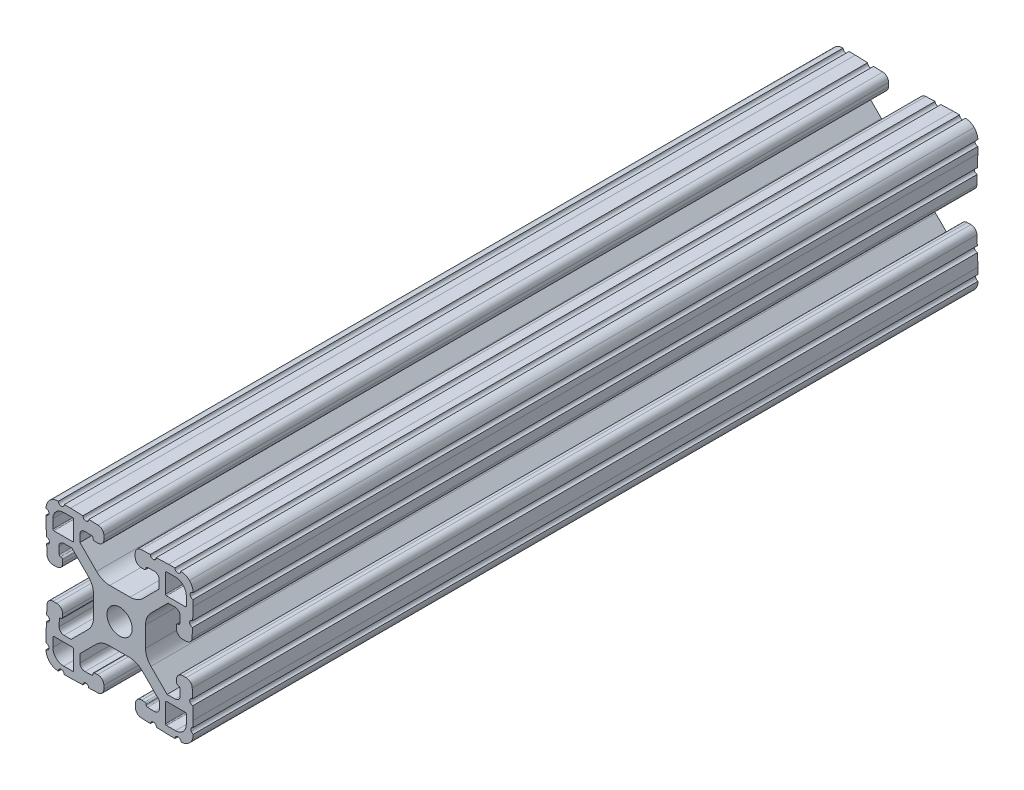
from build123d import *

# Parameters (mm, degrees)
SKETCH1_R           = 3.2639
BOSS_EXTRUDE1_DEPTH = 203.2


with BuildPart() as part:
    # Sketch1 → Boss-Extrude1 (new body)
    with BuildSketch(Plane(origin=(0, 0, -25.4), x_dir=(-1, 0, 0), z_dir=(0, 0, -1))):
        with BuildLine():
            Line((-88.043721549, 91.862643967), (-86.29674679, 91.923648859))
            ThreePointArc((-86.29674679, 91.923648859), (-85.370208675, 91.567983831), (-84.982425017, 90.654422489))
            Line((-84.982425017, 90.654422489), (-84.982425017, 88.800173916))
            Line((-84.982425017, 88.800173916), (-89.306565884, 84.476033049))
            ThreePointArc((-89.306565884, 84.476033049), (-90.866149908, 83.406077005), (-92.719610366, 83.029523439))
            Line((-92.719610366, 83.029523439), (-97.961628589, 83.029523439))
            ThreePointArc((-97.961628589, 83.029523439), (-99.779298356, 83.391080435), (-101.320244378, 84.42070765))
            Line((-101.320244378, 84.42070765), (-105.516001761, 88.616465033))
            Line((-105.516001761, 88.616465033), (-105.516001761, 90.731330035))
            ThreePointArc((-105.516001761, 90.731330035), (-105.128218103, 91.644891377), (-104.201679988, 92.000556406))
            Line((-104.201679988, 92.000556406), (-102.454705229, 91.939551513))
            ThreePointArc((-102.454705229, 91.939551513), (-102.193933359, 91.823448504), (-102.087001761, 91.558783602))
            ThreePointArc((-102.087001761, 91.558783602), (-102.010859042, 91.249291513), (-101.726191901, 91.105946874))
            Line((-101.726191901, 91.105946874), (-100.929727576, 91.078102142))
            ThreePointArc((-100.929727576, 91.078102142), (-99.780779944, 91.519102656), (-99.299905511, 92.651940638))
            Line((-99.299905511, 92.651940638), (-99.299905511, 93.566848638))
            ThreePointArc((-99.299905511, 93.566848638), (-99.741889517, 94.660796975), (-100.819746715, 95.140689345))
            Line((-100.819746715, 95.140689345), (-103.211918901, 95.224224422))
            ThreePointArc((-103.211918901, 95.224224422), (-104.000045777, 94.489281495), (-104.734990687, 95.277406522))
            Line((-104.734990687, 95.277406522), (-107.935905676, 95.389166912))
            Line((-107.935905676, 95.389166912), (-109.561454876, 95.389166912))
            ThreePointArc((-109.561454876, 95.389166912), (-110.323454876, 94.627166912), (-111.085454876, 95.389166912))
            ThreePointArc((-111.085454876, 95.389166912), (-112.308767787, 95.144035599), (-113.343184761, 94.446493225))
            ThreePointArc((-113.343184761, 94.446493225), (-114.04072548, 93.412075135), (-114.285854836, 92.188761832))
            ThreePointArc((-114.285854836, 92.188761832), (-113.523853616, 91.426762441), (-114.285853616, 90.664761832))
            Line((-114.285853616, 90.664761832), (-114.285853616, 89.039212632))
            Line((-114.285853616, 89.039212632), (-114.174093219, 85.838297643))
            ThreePointArc((-114.174093219, 85.838297643), (-113.385968191, 85.103352735), (-114.120911115, 84.315225857))
            Line((-114.120911115, 84.315225857), (-114.037376031, 81.923053667))
            ThreePointArc((-114.037376031, 81.923053667), (-113.55748366, 80.845196472), (-112.463535325, 80.403212468))
            Line((-112.463535325, 80.403212468), (-111.548627325, 80.403212468))
            ThreePointArc((-111.548627325, 80.403212468), (-110.415788905, 80.884087354), (-109.974788872, 82.033035791))
            Line((-109.974788872, 82.033035791), (-110.002634241, 82.829500094))
            ThreePointArc((-110.002634241, 82.829500094), (-110.118742417, 83.090261917), (-110.383401914, 83.197188))
            ThreePointArc((-110.383401914, 83.197188), (-110.693757401, 83.272605688), (-110.837665276, 83.557735272))
            Line((-110.837665276, 83.557735272), (-110.898671566, 85.304709982))
            ThreePointArc((-110.898671566, 85.304709982), (-110.543006925, 86.231248747), (-109.62944523, 86.61903277))
            Line((-109.62944523, 86.61903277), (-107.807161806, 86.61903277))
            Line((-107.807161806, 86.61903277), (-103.364925613, 82.176810793))
            ThreePointArc((-103.364925613, 82.176810793), (-102.335294479, 80.635862907), (-101.973736029, 78.81818963))
            Line((-101.973736029, 78.81818963), (-101.973736029, 73.576034207))
            ThreePointArc((-101.973736029, 73.576034207), (-102.335293752, 71.758362684), (-103.364922926, 70.21741573))
            Line((-103.364922926, 70.21741573), (-107.560683666, 66.021661704))
            Line((-107.560683666, 66.021661704), (-109.652436558, 66.021661704))
            ThreePointArc((-109.652436558, 66.021661704), (-110.565998503, 66.409445617), (-110.921663765, 67.335984343))
            Line((-110.921663765, 67.335984343), (-110.860658873, 69.082959102))
            ThreePointArc((-110.860658873, 69.082959102), (-110.744555864, 69.343730973), (-110.479890961, 69.45066257))
            ThreePointArc((-110.479890961, 69.45066257), (-110.173494703, 69.529390272), (-110.032185196, 69.812424443))
            Line((-110.032185196, 69.812424443), (-110.004340464, 70.608888768))
            ThreePointArc((-110.004340464, 70.608888768), (-110.445340978, 71.7578364), (-111.57817896, 72.238710833))
            Line((-111.57817896, 72.238710833), (-112.49308696, 72.238710833))
            ThreePointArc((-112.49308696, 72.238710833), (-113.587035297, 71.796726827), (-114.066927667, 70.718869629))
            Line((-114.066927667, 70.718869629), (-114.150462744, 68.326697443))
            ThreePointArc((-114.150462744, 68.326697443), (-113.415519817, 67.538570567), (-114.203644843, 66.803625657))
            Line((-114.203644843, 66.803625657), (-114.315405233, 63.602710668))
            Line((-114.315405233, 63.602710668), (-114.315405233, 61.962557497))
            ThreePointArc((-114.315405233, 61.962557497), (-113.701927281, 61.206106537), (-114.333208228, 60.464447842))
            ThreePointArc((-114.333208228, 60.464447842), (-114.113020459, 59.176546471), (-113.392816136, 58.086372941))
            ThreePointArc((-113.392816136, 58.086372941), (-112.358398046, 57.388832223), (-111.135084743, 57.143702867))
            ThreePointArc((-111.135084743, 57.143702867), (-110.373085352, 57.905704086), (-109.611084743, 57.143704086))
            Line((-109.611084743, 57.143704086), (-107.985535543, 57.143704086))
            Line((-107.985535543, 57.143704086), (-104.784620554, 57.255464483))
            ThreePointArc((-104.784620554, 57.255464483), (-104.049675645, 58.04358951), (-103.261548768, 57.308646586))
            Line((-103.261548768, 57.308646586), (-100.869376578, 57.39218167))
            ThreePointArc((-100.869376578, 57.39218167), (-99.791519383, 57.872074041), (-99.349535378, 58.966022376))
            Line((-99.349535378, 58.966022376), (-99.349535378, 59.880930376))
            ThreePointArc((-99.349535378, 59.880930376), (-99.830409811, 61.013768358), (-100.979357443, 61.454768873))
            Line((-100.979357443, 61.454768873), (-101.775821768, 61.42692414))
            ThreePointArc((-101.775821768, 61.42692414), (-102.036583684, 61.310816174), (-102.143509978, 61.046156762))
            ThreePointArc((-102.143509978, 61.046156762), (-102.222494916, 60.740061862), (-102.505377386, 60.598958297))
            Line((-102.505377386, 60.598958297), (-104.252352145, 60.537953405))
            ThreePointArc((-104.252352145, 60.537953405), (-105.17889026, 60.893618433), (-105.566673918, 61.807179775))
            Line((-105.566673918, 61.807179775), (-105.566673918, 63.629462758))
            Line((-105.566673918, 63.629462758), (-101.131142468, 68.064994208))
            ThreePointArc((-101.131142468, 68.064994208), (-99.590196446, 69.094621422), (-97.772526678, 69.456178419))
            Line((-97.772526678, 69.456178419), (-92.530356056, 69.456178419))
            ThreePointArc((-92.530356056, 69.456178419), (-90.712686289, 69.094621422), (-89.171740267, 68.064994208))
            Line((-89.171740267, 68.064994208), (-84.975982884, 63.869236825))
            Line((-84.975982884, 63.869236825), (-84.975982884, 61.781050107))
            ThreePointArc((-84.975982884, 61.781050107), (-85.363766542, 60.867488765), (-86.290304657, 60.511823736))
            Line((-86.290304657, 60.511823736), (-88.037279416, 60.572828629))
            ThreePointArc((-88.037279416, 60.572828629), (-88.298051286, 60.688931638), (-88.404982884, 60.95359654))
            ThreePointArc((-88.404982884, 60.95359654), (-88.466593694, 61.278962759), (-88.759626911, 61.433204782))
            Line((-88.759626911, 61.433204782), (-89.556091237, 61.461049514))
            ThreePointArc((-89.556091237, 61.461049514), (-90.705038868, 61.020049), (-91.185913301, 59.887211018))
            Line((-91.185913301, 59.887211018), (-91.185913301, 58.972303018))
            ThreePointArc((-91.185913301, 58.972303018), (-90.743929295, 57.878354681), (-89.666072098, 57.398462311))
            Line((-89.666072098, 57.398462311), (-87.273899911, 57.314927234))
            ThreePointArc((-87.273899911, 57.314927234), (-86.485773036, 58.049870161), (-85.750828126, 57.261745135))
            Line((-85.750828126, 57.261745135), (-82.549913136, 57.149984745))
            Line((-82.549913136, 57.149984745), (-80.924363936, 57.149984745))
            ThreePointArc((-80.924363936, 57.149984745), (-80.162363936, 57.911984745), (-79.400363936, 57.149984745))
            ThreePointArc((-79.400363936, 57.149984745), (-78.177051025, 57.395116058), (-77.142634052, 58.092658432))
            ThreePointArc((-77.142634052, 58.092658432), (-76.445094372, 59.127074031), (-76.199963977, 60.350384428))
            ThreePointArc((-76.199963977, 60.350384428), (-76.961961268, 61.112385783), (-76.199961268, 61.874384428))
            Line((-76.199961268, 61.874384428), (-76.199961268, 63.499933628))
            Line((-76.199961268, 63.499933628), (-76.311721666, 66.700848617))
            ThreePointArc((-76.311721666, 66.700848617), (-77.099846694, 67.435793525), (-76.364903769, 68.223920403))
            Line((-76.364903769, 68.223920403), (-76.448438853, 70.616092593))
            ThreePointArc((-76.448438853, 70.616092593), (-76.928331225, 71.693949788), (-78.02227956, 72.135933792))
            Line((-78.02227956, 72.135933792), (-78.93718756, 72.135933792))
            ThreePointArc((-78.93718756, 72.135933792), (-80.07002598, 71.655058906), (-80.511026012, 70.506110469))
            Line((-80.511026012, 70.506110469), (-80.483180643, 69.709646166))
            ThreePointArc((-80.483180643, 69.709646166), (-80.367072468, 69.448884343), (-80.102412971, 69.34195826))
            ThreePointArc((-80.102412971, 69.34195826), (-79.796317908, 69.262973649), (-79.655214052, 68.980091239))
            Line((-79.655214052, 68.980091239), (-79.594207761, 67.233116529))
            ThreePointArc((-79.594207761, 67.233116529), (-79.949872402, 66.306577764), (-80.863434097, 65.918793741))
            Line((-80.863434097, 65.918793741), (-82.685717521, 65.918793741))
            Line((-82.685717521, 65.918793741), (-87.121258001, 70.35431293))
            ThreePointArc((-87.121258001, 70.35431293), (-88.150863946, 71.895196205), (-88.512450271, 73.712794894))
            Line((-88.512450271, 73.712794894), (-88.512606864, 78.954950317))
            ThreePointArc((-88.512606864, 78.954950317), (-88.151076291, 80.772698182), (-87.121419968, 82.313710679))
            Line((-87.121419968, 82.313710679), (-82.925659228, 86.509464706))
            Line((-82.925659228, 86.509464706), (-80.837473527, 86.509464706))
            ThreePointArc((-80.837473527, 86.509464706), (-79.923911584, 86.121680793), (-79.568246321, 85.195142068))
            Line((-79.568246321, 85.195142068), (-79.629251214, 83.448167309))
            ThreePointArc((-79.629251214, 83.448167309), (-79.745354223, 83.187395438), (-80.010019125, 83.080463841))
            ThreePointArc((-80.010019125, 83.080463841), (-80.335385344, 83.018853031), (-80.489627367, 82.725819813))
            Line((-80.489627367, 82.725819813), (-80.5174721, 81.929355488))
            ThreePointArc((-80.5174721, 81.929355488), (-80.076471586, 80.780407856), (-78.943633603, 80.299533423))
            Line((-78.943633603, 80.299533423), (-78.028725603, 80.299533423))
            ThreePointArc((-78.028725603, 80.299533423), (-76.934777267, 80.741517429), (-76.454884897, 81.819374627))
            Line((-76.454884897, 81.819374627), (-76.37134982, 84.211546813))
            ThreePointArc((-76.37134982, 84.211546813), (-77.106292747, 84.999673689), (-76.31816772, 85.734618599))
            Line((-76.31816772, 85.734618599), (-76.20640733, 88.935533588))
            Line((-76.20640733, 88.935533588), (-76.20640733, 90.561082788))
            ThreePointArc((-76.20640733, 90.561082788), (-76.96840733, 91.323083398), (-76.206406111, 92.085082788))
            ThreePointArc((-76.206406111, 92.085082788), (-76.451535467, 93.308396091), (-77.149076185, 94.342814181))
            ThreePointArc((-77.149076185, 94.342814181), (-78.183493159, 95.040356555), (-79.40680607, 95.285487868))
            ThreePointArc((-79.40680607, 95.285487868), (-80.16880607, 94.523487868), (-80.93080607, 95.285487868))
            Line((-80.93080607, 95.285487868), (-82.55635527, 95.285487868))
            Line((-82.55635527, 95.285487868), (-85.757270259, 95.173727471))
            ThreePointArc((-85.757270259, 95.173727471), (-86.492215168, 94.385602444), (-87.280342045, 95.120545368))
            Line((-87.280342045, 95.120545368), (-89.672514235, 95.037010285))
            ThreePointArc((-89.672514235, 95.037010285), (-90.75037143, 94.557117913), (-91.192355435, 93.463169578))
            Line((-91.192355435, 93.463169578), (-91.192355435, 92.548261578))
            ThreePointArc((-91.192355435, 92.548261578), (-90.711481002, 91.415423596), (-89.56253337, 90.974423082))
            Line((-89.56253337, 90.974423082), (-88.766069045, 91.002267814))
            ThreePointArc((-88.766069045, 91.002267814), (-88.505307129, 91.11837578), (-88.398380835, 91.383035192))
            ThreePointArc((-88.398380835, 91.383035192), (-88.336765486, 91.708407548), (-88.043721549, 91.862643967))
        make_face()
        with Locations((-95.25, 76.2)):
            Circle(SKETCH1_R, mode=Mode.SUBTRACT)
        with BuildLine():
            Line((-83.357745393, 88.294108398), (-83.357745393, 93.170908398))
            ThreePointArc((-83.357745393, 93.170908398), (-83.283351492, 93.350512545), (-83.103748154, 93.424908398))
            Line((-83.103748154, 93.424908398), (-80.766975763, 93.424933798))
            ThreePointArc((-80.766975763, 93.424933798), (-78.791299784, 92.606600882), (-77.972945393, 90.630933798))
            Line((-77.972945393, 90.630933798), (-77.972945393, 88.294108398))
            ThreePointArc((-77.972945393, 88.294108398), (-78.047340271, 88.114503276), (-78.226945393, 88.040108398))
            Line((-78.226945393, 88.040108398), (-83.103745393, 88.040108398))
            ThreePointArc((-83.103745393, 88.040108398), (-83.283350516, 88.114503276), (-83.357745393, 88.294108398))
        make_face(mode=Mode.SUBTRACT)
        with BuildLine():
            Line((-83.357745393, 59.229091602), (-83.357745393, 64.105891602))
            ThreePointArc((-83.357745393, 64.105891602), (-83.283350516, 64.285496724), (-83.103745393, 64.359891602))
            Line((-83.103745393, 64.359891602), (-78.226945393, 64.359891602))
            ThreePointArc((-78.226945393, 64.359891602), (-78.047340271, 64.285496724), (-77.972945393, 64.105891602))
            Line((-77.972945393, 64.105891602), (-77.972945393, 61.769066202))
            ThreePointArc((-77.972945393, 61.769066202), (-78.791299784, 59.793399118), (-80.766975763, 58.975066202))
            Line((-80.766975763, 58.975066202), (-83.103748154, 58.975091602))
            ThreePointArc((-83.103748154, 58.975091602), (-83.283351492, 59.049487455), (-83.357745393, 59.229091602))
        make_face(mode=Mode.SUBTRACT)
        with BuildLine():
            Line((-107.142254607, 93.170908398), (-107.142254607, 88.294108398))
            ThreePointArc((-107.142254607, 88.294108398), (-107.216649484, 88.114503276), (-107.396254607, 88.040108398))
            Line((-107.396254607, 88.040108398), (-112.273054607, 88.040108398))
            ThreePointArc((-112.273054607, 88.040108398), (-112.452659729, 88.114503276), (-112.527054607, 88.294108398))
            Line((-112.527054607, 88.294108398), (-112.527054607, 90.630933798))
            ThreePointArc((-112.527054607, 90.630933798), (-111.708700216, 92.606600882), (-109.733024237, 93.424933798))
            Line((-109.733024237, 93.424933798), (-107.396251846, 93.424908398))
            ThreePointArc((-107.396251846, 93.424908398), (-107.216648508, 93.350512545), (-107.142254607, 93.170908398))
        make_face(mode=Mode.SUBTRACT)
        with BuildLine():
            Line((-107.142254607, 64.105891602), (-107.142254607, 59.229091602))
            ThreePointArc((-107.142254607, 59.229091602), (-107.216648508, 59.049487455), (-107.396251846, 58.975091602))
            Line((-107.396251846, 58.975091602), (-109.733024237, 58.975066202))
            ThreePointArc((-109.733024237, 58.975066202), (-111.708700216, 59.793399118), (-112.527054607, 61.769066202))
            Line((-112.527054607, 61.769066202), (-112.527054607, 64.105891602))
            ThreePointArc((-112.527054607, 64.105891602), (-112.452659729, 64.285496724), (-112.273054607, 64.359891602))
            Line((-112.273054607, 64.359891602), (-107.396254607, 64.359891602))
            ThreePointArc((-107.396254607, 64.359891602), (-107.216649484, 64.285496724), (-107.142254607, 64.105891602))
        make_face(mode=Mode.SUBTRACT)
    extrude(amount=-BOSS_EXTRUDE1_DEPTH)


solid = part.part
